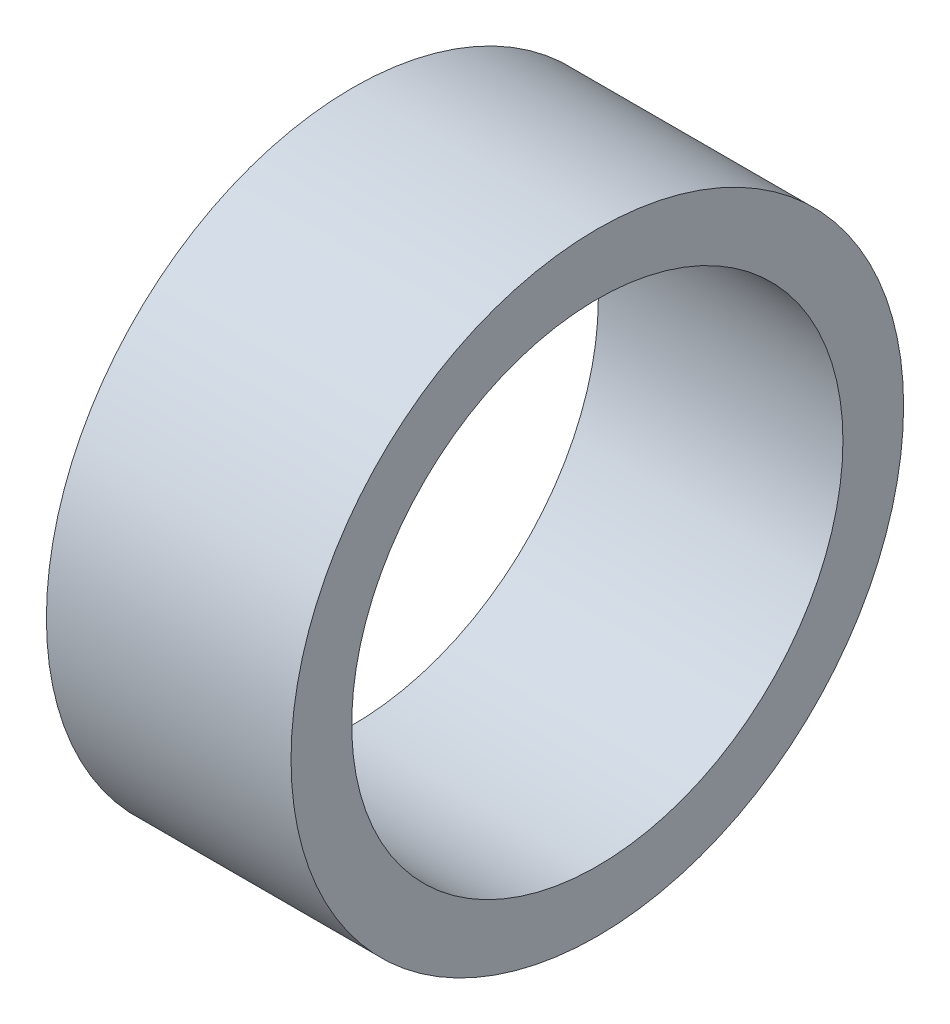
from build123d import *

# Parameters (mm, degrees)
SKETCH1_R           = 3.9751
SKETCH1_R_2         = 3.1877
BOSS_EXTRUDE1_DEPTH = 1.5875


with BuildPart() as part:
    # Sketch1 → Boss-Extrude1 (new, symmetric)
    with BuildSketch(Plane(origin=(0, 0, 0), x_dir=(0, 0, -1), z_dir=(1, 0, 0))):
        Circle(SKETCH1_R)
        Circle(SKETCH1_R_2, mode=Mode.SUBTRACT)
    extrude(amount=BOSS_EXTRUDE1_DEPTH, both=True)


solid = part.part
